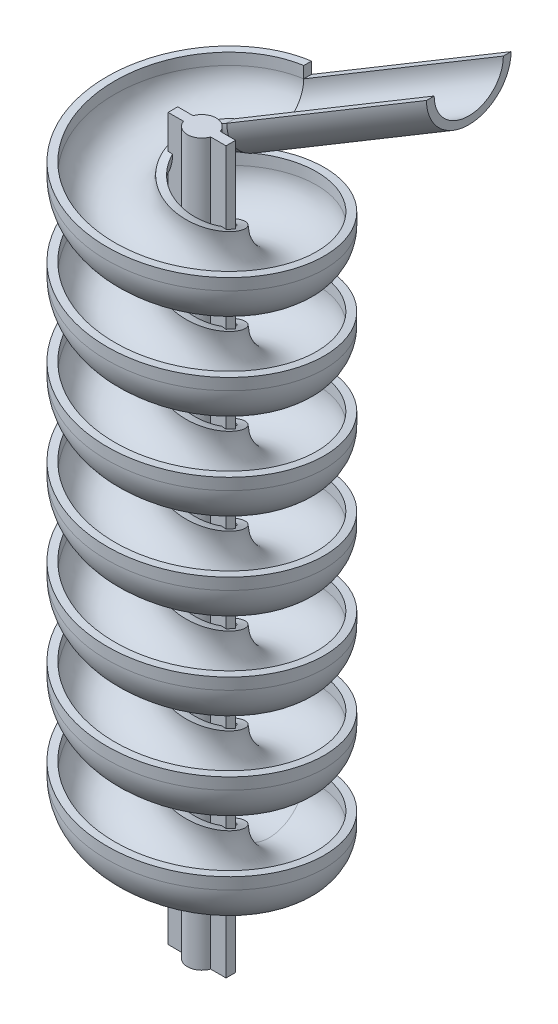
from build123d import *

# Parameters (mm, degrees)
SWEEP2_PITCH             = 45
SWEEP2_HEIGHT            = 315
SWEEP2_RADIUS            = 35
SWEEP2_START_ANGLE       = -180
BOSS_EXTRUDE1_DEPTH      = 320
BOSS_EXTRUDE1_DEPTH_BACK = 55


with BuildPart() as part:
    # Sweep2: sweep along a helix
    with BuildLine() as sweep2_path:
        add(Helix(SWEEP2_PITCH, SWEEP2_HEIGHT, SWEEP2_RADIUS, center=(0, 0, 0), direction=(0, 1, 0), lefthand=True, mode=Mode.PRIVATE).rotate(Axis((0, 0, 0), (0, 1, 0)), SWEEP2_START_ANGLE))
    # Sketch29 → Sweep2 (sweep)
    with BuildSketch(Plane(origin=(0, 0, 0), x_dir=(0, 0, -1), z_dir=(1, 0, 0))):
        with BuildLine():
            Line((12.996367686, 314.89723992), (16.996367686, 314.89723992))
            ThreePointArc((16.996367686, 314.89723992), (34.996367686, 296.89723992), (52.996367686, 314.89723992))
            Line((52.996367686, 314.89723992), (52.996367686, 320.89723992))
            Line((52.996367686, 320.89723992), (56.996367686, 320.89723992))
            Line((56.996367686, 320.89723992), (56.996367686, 314.89723992))
            ThreePointArc((56.996367686, 314.89723992), (34.996367686, 292.89723992), (12.996367686, 314.89723992))
        make_face()
    sweep(path=sweep2_path.line, is_frenet=True)

    # Sketch30 → Boss-Extrude1 (add, two sides: drawn at the far end of the back side and taken through both)
    with BuildSketch(Plane(origin=(0, 0, 0), x_dir=(1, 0, 0), z_dir=(0, 1, 0)).offset(-BOSS_EXTRUDE1_DEPTH_BACK)):
        with BuildLine():
            Line((-15.071067812, -2.5), (-15.071067812, 2.5))
            Line((-15.071067812, 2.5), (-7.071067812, 2.5))
            ThreePointArc((-7.071067812, 2.5), (0, 7.5), (7.071067812, 2.5))
            Line((7.071067812, 2.5), (15.071067812, 2.5))
            Line((15.071067812, 2.5), (15.071067812, -2.5))
            Line((15.071067812, -2.5), (7.071067812, -2.5))
            ThreePointArc((7.071067812, -2.5), (0, -7.5), (-7.071067812, -2.5))
            Line((-7.071067812, -2.5), (-15.071067812, -2.5))
        make_face()
    extrude(amount=BOSS_EXTRUDE1_DEPTH + BOSS_EXTRUDE1_DEPTH_BACK)

    # Sketch31 → Loft1 section 0
    with BuildSketch(Plane.ZY.offset(-61.871117345)):
        with BuildLine():
            Line((-99, 335.099234317), (-95, 335.099234317))
            ThreePointArc((-95, 335.099234317), (-77, 317.099234317), (-59, 335.099234317))
            Line((-59, 335.099234317), (-55, 335.099234317))
            ThreePointArc((-55, 335.099234317), (-77, 313.099234317), (-99, 335.099234317))
        make_face()
    # Sketch24 → Loft1 section 1
    with BuildSketch(Plane(origin=(0, 0, 0), x_dir=(0, 0, -1), z_dir=(1, 0, 0))):
        with BuildLine():
            Line((16.996367686, 314.89723992), (12.996367686, 314.89723992))
            ThreePointArc((12.996367686, 314.89723992), (34.996367686, 292.89723992), (56.996367686, 314.89723992))
            Line((56.996367686, 314.89723992), (52.996367686, 314.89723992))
            ThreePointArc((52.996367686, 314.89723992), (34.996367686, 296.89723992), (16.996367686, 314.89723992))
        make_face()
    loft()

    # Sketch32 → Loft2 section 0
    with BuildSketch(Plane(origin=(-57.575146107, 0, 0), x_dir=(0, 0, -1), z_dir=(1, 0, 0))):
        with BuildLine():
            Line((64.445381809, -11.560082115), (60.445381809, -11.560082115))
            ThreePointArc((60.445381809, -11.560082115), (42.445381809, -29.560082115), (24.445381809, -11.560082115))
            Line((24.445381809, -11.560082115), (20.445381809, -11.560082115))
            ThreePointArc((20.445381809, -11.560082115), (42.445381809, -33.560082115), (64.445381809, -11.560082115))
        make_face()
    # Sketch33 → Loft2 section 1
    with BuildSketch(Plane.ZY):
        with BuildLine():
            Line((-52.996367686, -0.10276008), (-56.996367686, -0.10276008))
            ThreePointArc((-56.996367686, -0.10276008), (-34.996367686, -22.10276008), (-12.996367686, -0.10276008))
            Line((-12.996367686, -0.10276008), (-16.996367686, -0.10276008))
            ThreePointArc((-16.996367686, -0.10276008), (-34.996367686, -18.10276008), (-52.996367686, -0.10276008))
        make_face()
    loft()


solid = part.part
